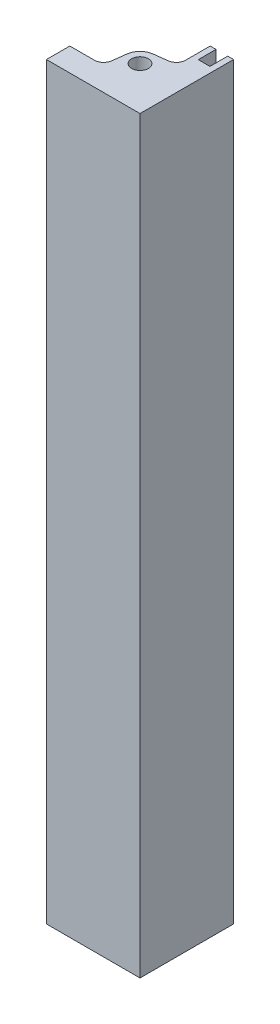
from build123d import *

# Parameters (mm, degrees)
BOSS_EXTRUDE1_DEPTH  = 203.2
SKETCH2_R            = 2.286
BOSS_EXTRUDE2_DEPTH  = 6.35
FILLET1_R            = 2.54
FILLET1_OF_MIRROR1_R = 2.54
SKETCH4_W            = 3.175
SKETCH4_H            = 4.826
CUT_EXTRUDE2_DEPTH   = 207.350575478
SKETCH5_W            = 19.05
SKETCH5_H            = 4.826
BOSS_EXTRUDE3_DEPTH  = 6.35


with BuildPart() as part:
    # Sketch1 → Boss-Extrude1 (new body)
    with BuildSketch(Plane(origin=(0, 0, 0), x_dir=(1, 0, 0), z_dir=(0, 1, 0))):
        Polygon((0, 0), (25.4, 0), (25.4, 25.4), (19.05, 25.4), (19.05, 6.35), (0, 6.35), align=None)
    extrude(amount=BOSS_EXTRUDE1_DEPTH)

    # Sketch2 → Boss-Extrude2 (add)
    with BuildSketch(Plane(origin=(0, 203.2, 0), x_dir=(1, 0, 0), z_dir=(0, 1, 0))):
        with BuildLine():
            Line((19.05, 16.51), (19.05, 6.35))
            Line((19.05, 6.35), (8.89, 6.35))
            Line((8.89, 6.35), (9.629456844, 12.244049961))
            ThreePointArc((9.629456844, 12.244049961), (10.788164369, 14.611835631), (13.155950039, 15.770543156))
            Line((13.155950039, 15.770543156), (19.05, 16.51))
        make_face()
        with Locations((13.661846327, 11.738153673)):
            Circle(SKETCH2_R, mode=Mode.SUBTRACT)
    boss_extrude2 = extrude(amount=-BOSS_EXTRUDE2_DEPTH)

    # Fillet1
    fillet1_edges = [part.edges().sort_by_distance(p)[0] for p in [
        (19.05, 200.025, -16.51),
        (8.89, 200.025, -6.35),
    ]]
    fillet(fillet1_edges, radius=FILLET1_R)

    # Mirror1: Boss-Extrude2 across plane
    add(boss_extrude2.mirror(Plane.ZX.offset(101.6)))

    # Fillet1 of Mirror1
    fillet1_of_mirror1_edges = [part.edges().sort_by_distance(p)[0] for p in [
        (19.05, 3.175, -16.51),
        (8.89, 3.175, -6.35),
    ]]
    fillet(fillet1_of_mirror1_edges, radius=FILLET1_OF_MIRROR1_R)

    # Sketch4 → Cut-Extrude2 (cut, through all)
    with BuildSketch(Plane.XZ):
        with Locations((22.225, -22.987)):
            Rectangle(SKETCH4_W, SKETCH4_H)
    extrude(amount=-CUT_EXTRUDE2_DEPTH, mode=Mode.SUBTRACT)

    # Sketch5 → Boss-Extrude3 (add)
    with BuildSketch(Plane.ZY.offset(-19.05)):
        with Locations((-15.875, 188.087)):
            Rectangle(SKETCH5_W, SKETCH5_H)
        with Locations((-15.875, 178.477333333)):
            Rectangle(SKETCH5_W, SKETCH5_H)
        with Locations((-15.875, 168.867666667)):
            Rectangle(SKETCH5_W, SKETCH5_H)
        with Locations((-15.875, 159.258)):
            Rectangle(SKETCH5_W, SKETCH5_H)
        with Locations((-15.875, 149.648333333)):
            Rectangle(SKETCH5_W, SKETCH5_H)
        with Locations((-15.875, 140.038666667)):
            Rectangle(SKETCH5_W, SKETCH5_H)
        with Locations((-15.875, 130.429)):
            Rectangle(SKETCH5_W, SKETCH5_H)
        with Locations((-15.875, 120.819333333)):
            Rectangle(SKETCH5_W, SKETCH5_H)
        with Locations((-15.875, 111.209666667)):
            Rectangle(SKETCH5_W, SKETCH5_H)
        with Locations((-15.875, 101.6)):
            Rectangle(SKETCH5_W, SKETCH5_H)
        with Locations((-15.875, 91.990333333)):
            Rectangle(SKETCH5_W, SKETCH5_H)
        with Locations((-15.875, 82.380666667)):
            Rectangle(SKETCH5_W, SKETCH5_H)
        with Locations((-15.875, 72.771)):
            Rectangle(SKETCH5_W, SKETCH5_H)
        with Locations((-15.875, 63.161333333)):
            Rectangle(SKETCH5_W, SKETCH5_H)
        with Locations((-15.875, 53.551666667)):
            Rectangle(SKETCH5_W, SKETCH5_H)
        with Locations((-15.875, 43.942)):
            Rectangle(SKETCH5_W, SKETCH5_H)
        with Locations((-15.875, 34.332333333)):
            Rectangle(SKETCH5_W, SKETCH5_H)
        with Locations((-15.875, 24.722666667)):
            Rectangle(SKETCH5_W, SKETCH5_H)
        with Locations((-15.875, 15.113)):
            Rectangle(SKETCH5_W, SKETCH5_H)
    extrude(amount=BOSS_EXTRUDE3_DEPTH)


solid = part.part
